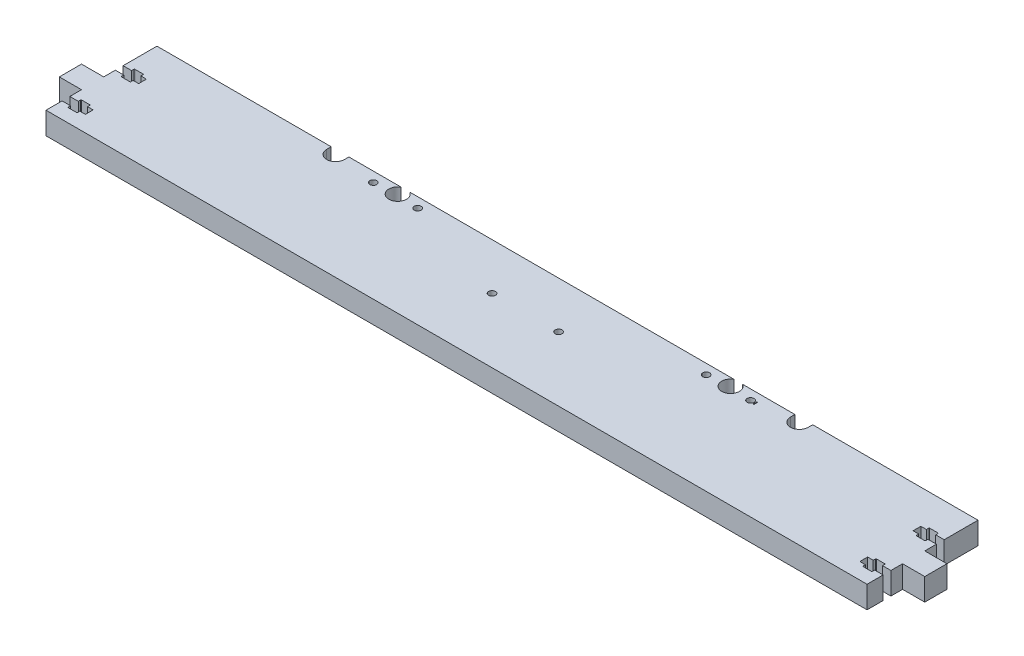
from build123d import *

# Parameters (mm, degrees)
MAINBODY_DEPTH                 = 10
SCREWCUTOUTS_DEPTH             = 197.85019685
SKETCH3_R                      = 4
SKETCH3_R_2                    = 1.55
RODCUTOUTS_DEPTH               = 197.85019685
SKETCH6_R                      = 1.55
CUT_EXTRUDE1_DEPTH             = 197.85019685
BEDADJUSTMENTSCREWCUTOUT_DEPTH = 197.85019685
DIRECTIONKEY_DEPTH             = 197.85019685


with BuildPart() as part:
    # Sketch1 → MainBody (new body)
    with BuildSketch(Plane(origin=(0, 0, 0), x_dir=(1, 0, 0), z_dir=(0, 1, 0))):
        Polygon((0, -25), (0, 25), (-185, 25), (-185, 1), (-195, 1), (-195, -9), (-185, -9), (-185, -25), align=None)
    mainbody = extrude(amount=MAINBODY_DEPTH)

    # Sketch5 → ScrewCutouts (cut, through all)
    with BuildSketch(Plane(origin=(0, 10, 0), x_dir=(1, 0, 0), z_dir=(0, 1, 0))):
        with BuildLine():
            Line((-185, 9.75), (-181.2, 9.75))
            Line((-181.2, 9.75), (-181.2, 10.75))
            ThreePointArc((-181.2, 10.75), (-181.126776695, 10.926776695), (-180.95, 11))
            Line((-180.95, 11), (-177.25, 11))
            ThreePointArc((-177.25, 11), (-177.073223305, 10.926776695), (-177, 10.75))
            Line((-177, 10.75), (-177, 9.75))
            Line((-177, 9.75), (-174.5, 9.75))
            Line((-174.5, 9.75), (-174.5, 6.25))
            Line((-174.5, 6.25), (-177, 6.25))
            Line((-177, 6.25), (-177, 5.25))
            ThreePointArc((-177, 5.25), (-177.073223305, 5.073223305), (-177.25, 5))
            Line((-177.25, 5), (-180.95, 5))
            ThreePointArc((-180.95, 5), (-181.126776695, 5.073223305), (-181.2, 5.25))
            Line((-181.2, 5.25), (-181.2, 6.25))
            Line((-181.2, 6.25), (-185, 6.25))
            Line((-185, 6.25), (-185, 9.75))
        make_face()
        with BuildLine():
            Line((-185, -14.25), (-181.2, -14.25))
            Line((-181.2, -14.25), (-181.2, -13.25))
            ThreePointArc((-181.2, -13.25), (-181.126776695, -13.073223305), (-180.95, -13))
            Line((-180.95, -13), (-177.25, -13))
            ThreePointArc((-177.25, -13), (-177.073223305, -13.073223305), (-177, -13.25))
            Line((-177, -13.25), (-177, -14.25))
            Line((-177, -14.25), (-174.5, -14.25))
            Line((-174.5, -14.25), (-174.5, -17.75))
            Line((-174.5, -17.75), (-177, -17.75))
            Line((-177, -17.75), (-177, -18.75))
            ThreePointArc((-177, -18.75), (-177.073223305, -18.926776695), (-177.25, -19))
            Line((-177.25, -19), (-180.95, -19))
            ThreePointArc((-180.95, -19), (-181.126776695, -18.926776695), (-181.2, -18.75))
            Line((-181.2, -18.75), (-181.2, -17.75))
            Line((-181.2, -17.75), (-185, -17.75))
            Line((-185, -17.75), (-185, -14.25))
        make_face()
    screwcutouts = extrude(amount=-SCREWCUTOUTS_DEPTH, mode=Mode.SUBTRACT)

    # Mirror1: MainBody, ScrewCutouts across plane
    add(mainbody.mirror(Plane(origin=(0, 0, 0), x_dir=(0, 0, 1), z_dir=(1, 0, 0))))
    add(screwcutouts.mirror(Plane(origin=(0, 0, 0), x_dir=(0, 0, 1), z_dir=(1, 0, 0))), mode=Mode.SUBTRACT)

    # Sketch3 → RodCutouts (cut, through all)
    with BuildSketch(Plane(origin=(0, 10, 0), x_dir=(1, 0, 0), z_dir=(0, 1, 0))):
        with Locations((-73, 21.5)):
            Circle(SKETCH3_R)
        with Locations((-83, 20.5)):
            Circle(SKETCH3_R_2)
        with Locations((-63, 20.5)):
            Circle(SKETCH3_R_2)
        with Locations((67, 20.5)):
            Circle(SKETCH3_R_2)
        with Locations((87, 20.5)):
            Circle(SKETCH3_R_2)
        with Locations((77, 21.5)):
            Circle(SKETCH3_R)
    extrude(amount=-RODCUTOUTS_DEPTH, mode=Mode.SUBTRACT)

    # Sketch6 → Cut-Extrude1 (cut, through all)
    with BuildSketch(Plane(origin=(0, 10, 0), x_dir=(1, 0, 0), z_dir=(0, 1, 0))):
        with Locations((-13, 4)):
            Circle(SKETCH6_R)
        with Locations((17, 4)):
            Circle(SKETCH6_R)
    extrude(amount=-CUT_EXTRUDE1_DEPTH, mode=Mode.SUBTRACT)

    # Sketch7 → BedAdjustmentScrewCutout (cut, through all)
    with BuildSketch(Plane(origin=(0, 10, 0), x_dir=(1, 0, 0), z_dir=(0, 1, 0))):
        with BuildLine():
            Line((-98.5, 25), (-98.5, 23))
            ThreePointArc((-98.5, 23), (-102.5, 19), (-106.5, 23))
            Line((-106.5, 23), (-106.5, 25))
            ThreePointArc((-106.5, 25), (-102.5, 29), (-98.5, 25))
        make_face()
        with BuildLine():
            Line((102.5, 25), (102.5, 23))
            ThreePointArc((102.5, 23), (106.5, 19), (110.5, 23))
            Line((110.5, 23), (110.5, 25))
            ThreePointArc((110.5, 25), (106.5, 29), (102.5, 25))
        make_face()
    extrude(amount=-BEDADJUSTMENTSCREWCUTOUT_DEPTH, mode=Mode.SUBTRACT)

    # Sketch8 → DirectionKey (cut, through all)
    with BuildSketch(Plane(origin=(0, 10, 0), x_dir=(1, 0, 0), z_dir=(0, 1, 0))):
        Polygon((88.35, 20.5), (89.35, 21.5), (89.35, 19.5), align=None)
    extrude(amount=-DIRECTIONKEY_DEPTH, mode=Mode.SUBTRACT)


solid = part.part
